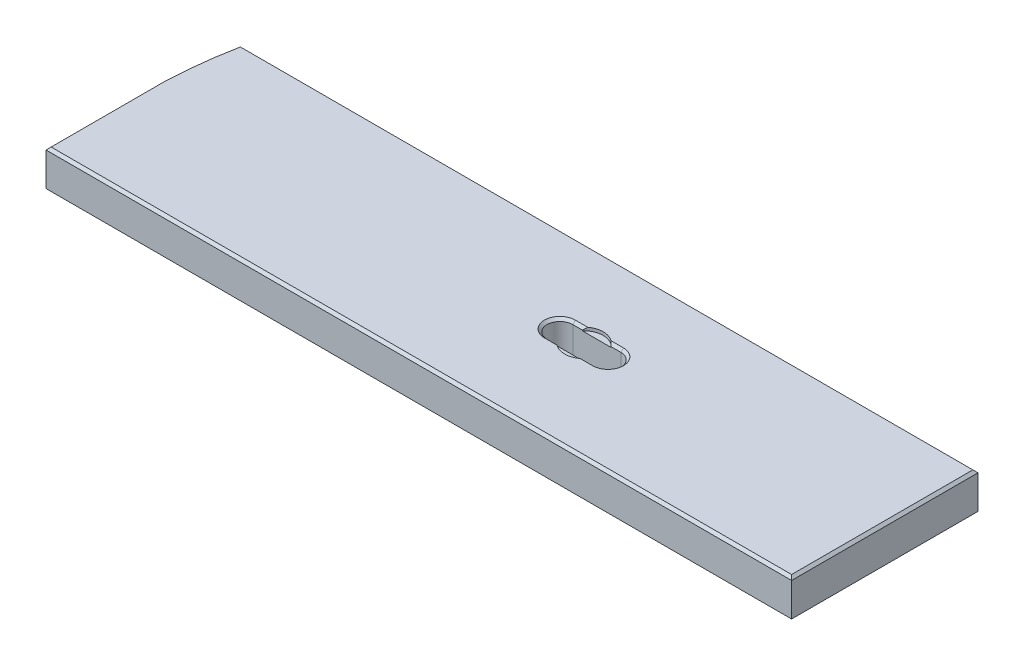
from build123d import *

# Parameters (mm, degrees)
SKETCH1_W           = 736.6
SKETCH1_H           = 184.15
BOSS_EXTRUDE1_DEPTH = 38.1
CUT_EXTRUDE2_DEPTH  = 761.225224851
CHAMFER1_SIZE       = 2.54
CHAMFER2_SIZE       = 2.54
SKETCH2_R           = 19.05
CUT_EXTRUDE1_DEPTH  = 3.175


with BuildPart() as part:
    # Sketch1 → Boss-Extrude1 (new body)
    with BuildSketch(Plane(origin=(0, 0, 0), x_dir=(1, 0, 0), z_dir=(0, 1, 0))):
        with Locations((368.3, 92.075)):
            Rectangle(SKETCH1_W, SKETCH1_H)
        with BuildLine():
            Line((409.5623, 110.83925), (457.1238, 110.83925))
            ThreePointArc((457.1238, 110.83925), (469.8238, 98.13925), (457.1238, 85.43925))
            Line((457.1238, 85.43925), (409.5623, 85.43925))
            ThreePointArc((409.5623, 85.43925), (396.8623, 98.13925), (409.5623, 110.83925))
        make_face(mode=Mode.SUBTRACT)
    extrude(amount=BOSS_EXTRUDE1_DEPTH)

    # Sketch4 → Cut-Extrude2 (cut, through all)
    with BuildSketch(Plane.XZ):
        with BuildLine():
            Line((0, -184.15), (0, -113.957302712))
            ThreePointArc((0, -113.957302712), (2.738891811, -149.223945145), (8.343201677, -184.15))
            Line((8.343201677, -184.15), (0, -184.15))
        make_face()
    extrude(amount=-CUT_EXTRUDE2_DEPTH, mode=Mode.SUBTRACT)

    # Chamfer1
    # the kernel refuses this chamfer: 2.54 mm, written as the material it takes off along each edge
    with BuildSketch(Plane(origin=(736.6, 38.1, 6.532074789), x_dir=(0.027495876610568244, -0.9996219169112971, 0), z_dir=(0, 0, -1))) as chamfer1_piece_1:
        Polygon((CHAMFER1_SIZE * 0.999621916911, CHAMFER1_SIZE * 0.0274958766106), (-CHAMFER1_SIZE * 0.0274958766106, CHAMFER1_SIZE * 0.999621916911), (0, 0), align=None)
    extrude(amount=197.214149579, mode=Mode.SUBTRACT)
    with BuildSketch(Plane(origin=(457.1238, 38.1, -98.13925), x_dir=(0, 0, -1), z_dir=(-1, 0, 0))) as chamfer1_piece_2:
        Polygon((12.7 + CHAMFER1_SIZE, 0), (12.7, CHAMFER1_SIZE), (12.7, 0), align=None)
    revolve(axis=Axis((457.1238, 38.1, -98.13925), (0, -1, 0)), revolution_arc=180, mode=Mode.SUBTRACT)
    with BuildSketch(Plane(origin=(743.132074789, 38.1, -184.15), x_dir=(0, 0.027495876610587267, 0.9996219169112966), z_dir=(-1, 0, 0))) as chamfer1_piece_3:
        Polygon((CHAMFER1_SIZE * 0.999621916911, -CHAMFER1_SIZE * 0.0274958766106), (-CHAMFER1_SIZE * 0.0274958766106, -CHAMFER1_SIZE * 0.999621916911), (0, 0), align=None)
    extrude(amount=741.320947902, mode=Mode.SUBTRACT)
    with BuildSketch(Plane(origin=(409.5623, 38.1, -110.83925), x_dir=(0, 0.027495876610587267, -0.9996219169112966), z_dir=(1, 0, 0)), Plane(origin=(457.1238, 38.1, -85.43925), x_dir=(0, 0.027495876610587267, 0.9996219169112966), z_dir=(-1, 0, 0))) as chamfer1_piece_4:
        Polygon((CHAMFER1_SIZE * 0.999621916911, -CHAMFER1_SIZE * 0.0274958766106), (-CHAMFER1_SIZE * 0.0274958766106, -CHAMFER1_SIZE * 0.999621916911), (0, 0), align=None)
    extrude(amount=47.5615, mode=Mode.SUBTRACT)
    with BuildSketch(Plane(origin=(409.5623, 38.1, -98.13925), x_dir=(0, 0, 1), z_dir=(1, 0, 0))) as chamfer1_piece_5:
        Polygon((12.7 + CHAMFER1_SIZE, 0), (12.7, CHAMFER1_SIZE), (12.7, 0), align=None)
    revolve(axis=Axis((409.5623, 38.1, -98.13925), (0, -1, 0)), revolution_arc=180, mode=Mode.SUBTRACT)
    with BuildSketch(Plane(origin=(0, 38.1, -120.489377502), x_dir=(-0.02749587661058648, -0.9996219169112968, 0), z_dir=(0, 0, 1))) as chamfer1_piece_6:
        Polygon((CHAMFER1_SIZE * 0.999621916911, CHAMFER1_SIZE * 0.0274958766106), (-CHAMFER1_SIZE * 0.0274958766106, CHAMFER1_SIZE * 0.999621916911), (0, 0), align=None)
    extrude(amount=127.021452291, mode=Mode.SUBTRACT)
    with BuildSketch(Plane(origin=(433.324, 38.1, -98.044), x_dir=(-0.9997657983904642, 0, -0.021641357828885384), z_dir=(-0.021641357828885384, 0, 0.9997657983904642))) as chamfer1_piece_7:
        Polygon((433.6161 - CHAMFER1_SIZE, 0), (433.6161, CHAMFER1_SIZE), (433.6161, 0), align=None)
    revolve(axis=Axis((433.324, 38.1, -98.044), (0, -1, 0)), revolution_arc=11.076796252, mode=Mode.SUBTRACT)
    with BuildSketch(Plane(origin=(-6.532074789, 38.1, 0), x_dir=(0, -0.9996219169112968, 0.027495876610586393), z_dir=(1, 0, 0))) as chamfer1_piece_8:
        Polygon((CHAMFER1_SIZE * 0.999621916911, CHAMFER1_SIZE * 0.0274958766106), (-CHAMFER1_SIZE * 0.0274958766106, CHAMFER1_SIZE * 0.999621916911), (0, 0), align=None)
    extrude(amount=749.664149579, mode=Mode.SUBTRACT)

    # Chamfer2
    # the kernel refuses this chamfer: 2.54 mm, written as the material it takes off along each edge
    with BuildSketch(Plane(origin=(457.1238, 0, -98.13925), x_dir=(0, 0, -1), z_dir=(-1, 0, 0))) as chamfer2_piece_1:
        Polygon((12.7 + CHAMFER2_SIZE, 0), (12.7, -CHAMFER2_SIZE), (12.7, 0), align=None)
    revolve(axis=Axis((457.1238, 0, -98.13925), (0, -1, 0)), revolution_arc=180, mode=Mode.SUBTRACT)
    with BuildSketch(Plane(origin=(409.5623, 0, -110.83925), x_dir=(0, -0.027495876610586324, -0.9996219169112968), z_dir=(1, 0, 0)), Plane(origin=(457.1238, 0, -85.43925), x_dir=(0, -0.027495876610586324, 0.9996219169112968), z_dir=(-1, 0, 0))) as chamfer2_piece_2:
        Polygon((CHAMFER2_SIZE * 0.999621916911, CHAMFER2_SIZE * 0.0274958766106), (-CHAMFER2_SIZE * 0.0274958766106, CHAMFER2_SIZE * 0.999621916911), (0, 0), align=None)
    extrude(amount=47.5615, mode=Mode.SUBTRACT)
    with BuildSketch(Plane(origin=(409.5623, 0, -98.13925), x_dir=(0, 0, 1), z_dir=(1, 0, 0))) as chamfer2_piece_3:
        Polygon((12.7 + CHAMFER2_SIZE, 0), (12.7, -CHAMFER2_SIZE), (12.7, 0), align=None)
    revolve(axis=Axis((409.5623, 0, -98.13925), (0, -1, 0)), revolution_arc=180, mode=Mode.SUBTRACT)
    with BuildSketch(Plane(origin=(0, 0, -120.489377502), x_dir=(0.9996219169112968, -0.02749587661058605, 0), z_dir=(0, 0, 1))) as chamfer2_piece_4:
        Polygon((CHAMFER2_SIZE * 0.999621916911, CHAMFER2_SIZE * 0.0274958766106), (-CHAMFER2_SIZE * 0.0274958766106, CHAMFER2_SIZE * 0.999621916911), (0, 0), align=None)
    extrude(amount=127.021452291, mode=Mode.SUBTRACT)
    with BuildSketch(Plane(origin=(433.324, 0, -98.044), x_dir=(-0.9997657983904642, 0, -0.021641357828885415), z_dir=(-0.021641357828885415, 0, 0.9997657983904642))) as chamfer2_piece_5:
        Polygon((433.6161 - CHAMFER2_SIZE, 0), (433.6161, -CHAMFER2_SIZE), (433.6161, 0), align=None)
    revolve(axis=Axis((433.324, 0, -98.044), (0, -1, 0)), revolution_arc=11.076796252, mode=Mode.SUBTRACT)
    with BuildSketch(Plane(origin=(743.132074789, 0, -184.15), x_dir=(0, -0.027495876610586403, 0.9996219169112968), z_dir=(-1, 0, 0))) as chamfer2_piece_6:
        Polygon((CHAMFER2_SIZE * 0.999621916911, CHAMFER2_SIZE * 0.0274958766106), (-CHAMFER2_SIZE * 0.0274958766106, CHAMFER2_SIZE * 0.999621916911), (0, 0), align=None)
    extrude(amount=741.320947902, mode=Mode.SUBTRACT)
    with BuildSketch(Plane(origin=(736.6, 0, 6.532074789), x_dir=(-0.9996219169112966, -0.027495876610587444, 0), z_dir=(0, 0, -1))) as chamfer2_piece_7:
        Polygon((CHAMFER2_SIZE * 0.999621916911, CHAMFER2_SIZE * 0.0274958766106), (-CHAMFER2_SIZE * 0.0274958766106, CHAMFER2_SIZE * 0.999621916911), (0, 0), align=None)
    extrude(amount=197.214149579, mode=Mode.SUBTRACT)
    with BuildSketch(Plane(origin=(-6.532074789, 0, 0), x_dir=(0, 0.9996219169112968, 0.027495876610586407), z_dir=(1, 0, 0))) as chamfer2_piece_8:
        Polygon((CHAMFER2_SIZE * 0.999621916911, -CHAMFER2_SIZE * 0.0274958766106), (-CHAMFER2_SIZE * 0.0274958766106, -CHAMFER2_SIZE * 0.999621916911), (0, 0), align=None)
    extrude(amount=749.664149579, mode=Mode.SUBTRACT)

    # Sketch2 → Cut-Extrude1 (cut)
    with BuildSketch(Plane(origin=(0, 38.1, 0), x_dir=(1, 0, 0), z_dir=(0, 1, 0))):
        with Locations((433.34305, 98.13925)):
            Circle(SKETCH2_R)
    extrude(amount=-CUT_EXTRUDE1_DEPTH, mode=Mode.SUBTRACT)


solid = part.part
